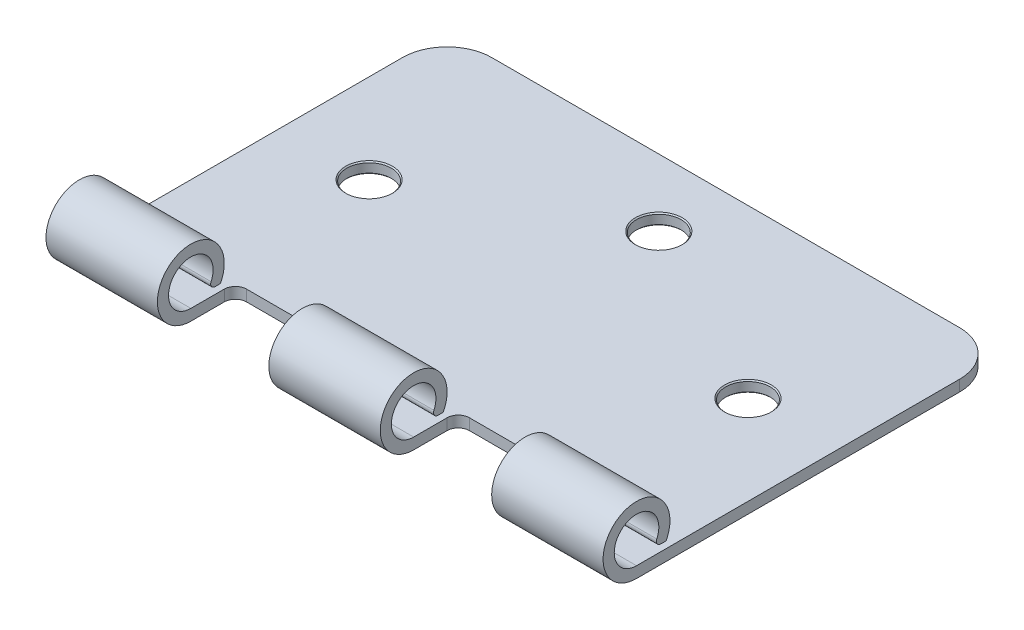
from build123d import *

# Parameters (mm, degrees)
SKETCH1_R           = 10
BOSS_EXTRUDE1_DEPTH = 5
BOSS_EXTRUDE2_DEPTH = 125
SKETCH3_W           = 50
SKETCH3_H           = 35
CUT_EXTRUDE1_DEPTH  = 30
CHAMFER1_SIZE       = 0.5
FILLET2_R           = 5
WRAP1_OUTLINE_W     = 1.13974359
WRAP1_OUTLINE_H     = 12.7
WRAP1_DEPTH         = 5
WRAP2_DEPTH         = 2


# Read off the part's stored shape, not the designer's step: Wrap1, Wrap2
with BuildPart() as part:
    # Sketch1 → Boss-Extrude1 (new body)
    with BuildSketch(Plane(origin=(0, 0, 0), x_dir=(1, 0, 0), z_dir=(0, 1, 0))):
        with BuildLine():
            Line((-105, 150), (105, 150))
            ThreePointArc((105, 150), (119.142135624, 144.142135624), (125, 130))
            Line((125, 130), (125, 0))
            Line((125, 0), (-125, 0))
            Line((-125, 0), (-125, 130))
            ThreePointArc((-125, 130), (-119.142135624, 144.142135624), (-105, 150))
        make_face()
        with Locations(Location((-85, 75, 0), (0, 0, 270))):
            Circle(SKETCH1_R, mode=Mode.SUBTRACT)
        with Locations(Location((85, 75, 0), (0, 0, 270))):
            Circle(SKETCH1_R, mode=Mode.SUBTRACT)
        with Locations(Location((0, 120, 0), (0, 0, 270))):
            Circle(SKETCH1_R, mode=Mode.SUBTRACT)
    extrude(amount=BOSS_EXTRUDE1_DEPTH)

    # Sketch2 → Boss-Extrude2 (add, symmetric)
    with BuildSketch(Plane(origin=(0, 0, 0), x_dir=(0, 0, -1), z_dir=(1, 0, 0))):
        with BuildLine():
            Line((0, 0), (-15, 0))
            ThreePointArc((-15, 0), (-22.745966692, 27.845232579), (-1.733500839, 8))
            Line((-1.733500839, 8), (-4.091287885, 8))
            ThreePointArc((-4.091287885, 8), (-5.774538708, 8.91987655), (-5.909406571, 10.833333333))
            ThreePointArc((-5.909406571, 10.833333333), (-20.400617249, 23.416254115), (-15, 5))
            Line((-15, 5), (0, 5))
            Line((0, 5), (0, 0))
        make_face()
    extrude(amount=BOSS_EXTRUDE2_DEPTH, both=True)

    # Sketch3 → Cut-Extrude1 (cut, symmetric)
    with BuildSketch(Plane(origin=(0, 0, 0), x_dir=(1, 0, 0), z_dir=(0, 1, 0))):
        with Locations((-50, -12.5)):
            Rectangle(SKETCH3_W, SKETCH3_H)
        with Locations((50, -12.5)):
            Rectangle(SKETCH3_W, SKETCH3_H)
    extrude(amount=CUT_EXTRUDE1_DEPTH, both=True, mode=Mode.SUBTRACT)

    # Chamfer1
    chamfer1_edges = [part.edges().sort_by_distance(p)[0] for p in [
        (-85, 0, -85),
        (-85, 5, -85),
        (85, 0, -85),
        (85, 5, -85),
        (0, 0, -130),
        (0, 5, -130),
    ]]
    chamfer(chamfer1_edges, length=CHAMFER1_SIZE)

    # Fillet2
    fillet2_edges = [part.edges().sort_by_distance(p)[0] for p in [
        (-25, 2.5, -5),
        (-75, 2.5, -5),
        (75, 2.5, -5),
        (25, 2.5, -5),
    ]]
    fillet(fillet2_edges, radius=FILLET2_R)

    # Wrap1 outline → Wrap1 (add)
    # profile 1 of 17: a face of its own
    with BuildSketch(Plane.XZ):
        with BuildLine():
            add(Edge.make_bspline(
                [(-60.70987489, -35.845821008), (-60.610023001, -36.012968919), (-60.418710634, -36.333217866), (-60.099572845, -36.765954184), (-59.768890568, -37.13375401), (-59.424214986, -37.4344777), (-59.067649974, -37.671237947), (-58.696867836, -37.838886045), (-58.313118066, -37.94344687), (-58.051955914, -37.956147184), (-57.921573608, -37.962487674)],
                knots=[0, 0, 0, 0, 0.159004299, 0.3046461, 0.438546905, 0.562322299, 0.677432543, 0.786897393, 0.893610889, 1, 1, 1, 1], degree=3))
            Line((-60.70987489, -35.845821008), (-61.783472647, -36.489470848))
            add(Edge.make_bspline(
                [(-57.921573608, -39.265051777), (-58.017496139, -39.263196918), (-58.208133154, -39.25951056), (-58.490107559, -39.226921343), (-58.766385497, -39.18081271), (-59.033500178, -39.107609656), (-59.294893072, -39.018793196), (-59.549427323, -38.909434104), (-59.797226289, -38.778380258), (-60.039678662, -38.628538312), (-60.276167809, -38.454157353), (-60.504475593, -38.251053523), (-60.732092923, -38.024828405), (-60.952301476, -37.769338646), (-61.169555456, -37.488711889), (-61.3795714, -37.180322566), (-61.586696489, -36.845850454), (-61.716655473, -36.610482857), (-61.783472647, -36.489470848)],
                knots=[0, 0, 0, 0, 0.057208269, 0.11369606, 0.169177916, 0.224159217, 0.278719878, 0.333794217, 0.389241459, 0.445822073, 0.503704281, 0.564293892, 0.627975416, 0.69503826, 0.765372726, 0.839611443, 0.91753775, 1, 1, 1, 1], degree=3))
            add(Edge.make_bspline(
                [(-54.293729057, -35.828012514), (-54.29611353, -35.941871153), (-54.30083617, -36.167377374), (-54.355122914, -36.498502938), (-54.434659985, -36.82010638), (-54.554537948, -37.128212416), (-54.700853408, -37.428457698), (-54.886513793, -37.712966365), (-55.101715964, -37.988035297), (-55.348581339, -38.24632968), (-55.618713613, -38.48344302), (-55.90422302, -38.694368471), (-56.205576867, -38.870239245), (-56.521140359, -39.0137523), (-56.850985981, -39.125996778), (-57.195002797, -39.207323475), (-57.55375788, -39.257237054), (-57.797599628, -39.262417789), (-57.921573608, -39.265051777)],
                knots=[0, 0, 0, 0, 0.061484255, 0.121774528, 0.18091956, 0.240256115, 0.300114444, 0.361145948, 0.423500582, 0.488669361, 0.553954105, 0.617581261, 0.680238427, 0.742187389, 0.804663212, 0.868258989, 0.933020257, 1, 1, 1, 1], degree=3))
            add(Edge.make_bspline(
                [(-57.28555598, -31.729514918), (-57.147721381, -31.829813566), (-56.880823782, -32.024027995), (-56.501066277, -32.315822034), (-56.156737317, -32.60120108), (-55.846627978, -32.878342683), (-55.567674624, -33.145144621), (-55.322972038, -33.404816732), (-55.110026855, -33.655498667), (-54.880776548, -33.976890585), (-54.646523889, -34.371610519), (-54.445350419, -34.855220128), (-54.318501558, -35.340709633), (-54.301913488, -35.667015583), (-54.293729057, -35.828012514)],
                knots=[0, 0, 0, 0, 0.09697231, 0.187773439, 0.272396139, 0.351320997, 0.424334774, 0.491908784, 0.55423322, 0.611267658, 0.716347845, 0.814540086, 0.908495456, 1, 1, 1, 1], degree=3))
            add(Edge.make_bspline(
                [(-58.992627294, -30.465111873), (-58.964827457, -30.48992051), (-58.898781408, -30.548860151), (-58.778037335, -30.645352141), (-58.618587752, -30.764379343), (-58.424596337, -30.91165332), (-58.192486196, -31.082491769), (-57.922231806, -31.274710304), (-57.616845673, -31.49454897), (-57.400140435, -31.648246331), (-57.28555598, -31.729514918)],
                knots=[0, 0, 0, 0, 0.052594282, 0.124951974, 0.218093899, 0.333502411, 0.468789179, 0.624937586, 0.801683048, 1, 1, 1, 1], degree=3))
            add(Edge.make_bspline(
                [(-59.829626493, -28.824186392), (-59.828200005, -28.892227472), (-59.825344696, -29.028420891), (-59.785521859, -29.229630336), (-59.734361437, -29.430331482), (-59.653289601, -29.629621997), (-59.541365214, -29.830987243), (-59.39438929, -30.03789469), (-59.209283843, -30.252168033), (-59.067490113, -30.391531932), (-58.992627294, -30.465111873)],
                knots=[0, 0, 0, 0, 0.107285214, 0.214745861, 0.32293856, 0.434116163, 0.553412311, 0.686072985, 0.834255992, 1, 1, 1, 1], degree=3))
            add(Edge.make_bspline(
                [(-57.967366878, -27.216333828), (-58.098563402, -27.220730568), (-58.35156354, -27.229209267), (-58.710756682, -27.321810356), (-59.034040353, -27.467613106), (-59.311816803, -27.671956027), (-59.543090977, -27.914057915), (-59.710387928, -28.192655475), (-59.811081382, -28.500294478), (-59.823368739, -28.714894203), (-59.829626493, -28.824186392)],
                knots=[0, 0, 0, 0, 0.143073084, 0.275902964, 0.402370856, 0.528413645, 0.650356379, 0.765895086, 0.880774131, 1, 1, 1, 1], degree=3))
            add(Edge.make_bspline(
                [(-55.486898128, -28.844538956), (-55.549113368, -28.764388566), (-55.668925375, -28.610037652), (-55.850823799, -28.393878879), (-56.022268893, -28.196424796), (-56.191180344, -28.024919903), (-56.348637235, -27.869972162), (-56.501461931, -27.737312473), (-56.647455149, -27.625641026), (-56.831485081, -27.506465823), (-57.062689374, -27.388332224), (-57.352918977, -27.288368427), (-57.656217746, -27.228297202), (-57.86279098, -27.220354667), (-57.967366878, -27.216333828)],
                knots=[0, 0, 0, 0, 0.098469431, 0.189629101, 0.274184089, 0.352183161, 0.423198873, 0.488550946, 0.548473346, 0.601440164, 0.701198082, 0.799591802, 0.898545098, 1, 1, 1, 1], degree=3))
            Line((-55.486898128, -28.844538956), (-54.45654957, -28.063509309))
            add(Edge.make_bspline(
                [(-57.840163352, -25.913769726), (-57.690506188, -25.918931556), (-57.392885855, -25.929196788), (-56.955101558, -26.018450688), (-56.533604101, -26.166135982), (-56.194538541, -26.333734827), (-55.929171092, -26.501125964), (-55.726795747, -26.653597898), (-55.52171814, -26.829130435), (-55.312284056, -27.028191128), (-55.102042234, -27.252606482), (-54.887871422, -27.500839553), (-54.669270789, -27.771373341), (-54.528642383, -27.964502244), (-54.45654957, -28.063509309)],
                knots=[0, 0, 0, 0, 0.107232799, 0.213251813, 0.318830447, 0.426793531, 0.483645951, 0.543603822, 0.60830765, 0.67712676, 0.750685636, 0.828713418, 0.912190348, 1, 1, 1, 1], degree=3))
            add(Edge.make_bspline(
                [(-60.969370083, -28.877611873), (-60.964634039, -28.743246691), (-60.95526318, -28.477388288), (-60.876013303, -28.089019275), (-60.750925946, -27.718228561), (-60.575684496, -27.368687065), (-60.349779244, -27.04949622), (-60.08835528, -26.756984424), (-59.776982173, -26.511081283), (-59.435342654, -26.2962261), (-59.061395247, -26.128056599), (-58.66954254, -26.001198186), (-58.259161736, -25.929318879), (-57.98120179, -25.919003704), (-57.840163352, -25.913769726)],
                knots=[0, 0, 0, 0, 0.083785371, 0.165779888, 0.246280008, 0.327460928, 0.408796954, 0.489715241, 0.571376032, 0.655523321, 0.741019483, 0.826546761, 0.911988852, 1, 1, 1, 1], degree=3))
            add(Edge.make_bspline(
                [(-60.25957441, -30.811105463), (-60.315717645, -30.736353129), (-60.426130853, -30.589342633), (-60.571876073, -30.359563863), (-60.695752463, -30.124348014), (-60.792861497, -29.88306302), (-60.874635777, -29.639096278), (-60.929637411, -29.389264615), (-60.964077623, -29.134689057), (-60.967604545, -28.963371497), (-60.969370083, -28.877611873)],
                knots=[0, 0, 0, 0, 0.133506769, 0.262558979, 0.388264447, 0.512667355, 0.63372227, 0.75539386, 0.877552945, 1, 1, 1, 1], degree=3))
            add(Edge.make_bspline(
                [(-58.17852473, -32.538529341), (-58.312143231, -32.443357037), (-58.567611629, -32.26139484), (-58.924875627, -31.99134101), (-59.24435125, -31.744438969), (-59.524618539, -31.51836441), (-59.765554219, -31.313086673), (-59.969056882, -31.130577008), (-60.129942503, -30.965899516), (-60.219407039, -30.859069505), (-60.25957441, -30.811105463)],
                knots=[0, 0, 0, 0, 0.181535301, 0.347081672, 0.495567816, 0.628357302, 0.74551967, 0.845830751, 0.930781807, 1, 1, 1, 1], degree=3))
            add(Edge.make_bspline(
                [(-55.888861269, -34.563609469), (-55.945723212, -34.490868138), (-56.065097748, -34.338156812), (-56.270320722, -34.1108441), (-56.511134908, -33.876371551), (-56.779299236, -33.62578583), (-57.084582159, -33.37074154), (-57.417421997, -33.099076645), (-57.786316571, -32.821122351), (-58.045031887, -32.634713328), (-58.17852473, -32.538529341)],
                knots=[0, 0, 0, 0, 0.090279215, 0.189529918, 0.299197872, 0.418925887, 0.548376285, 0.68813637, 0.839083502, 1, 1, 1, 1], degree=3))
            add(Edge.make_bspline(
                [(-55.433472647, -35.810204021), (-55.438822289, -35.704464366), (-55.449697328, -35.4895111), (-55.541614413, -35.172375216), (-55.686210252, -34.858530748), (-55.81960613, -34.664397584), (-55.888861269, -34.563609469)],
                knots=[0, 0, 0, 0, 0.234723374, 0.477158319, 0.728556284, 1, 1, 1, 1], degree=3))
            add(Edge.make_bspline(
                [(-57.921573608, -37.962487674), (-57.810224143, -37.959386434), (-57.589473567, -37.953238218), (-57.264490571, -37.894162165), (-56.948870888, -37.803403869), (-56.649119546, -37.67342506), (-56.369372601, -37.516168269), (-56.124056878, -37.326226425), (-55.911980982, -37.113569621), (-55.738502195, -36.876323989), (-55.605406067, -36.621173192), (-55.503109133, -36.359277597), (-55.446339866, -36.086523078), (-55.437788217, -35.902879399), (-55.433472647, -35.810204021)],
                knots=[0, 0, 0, 0, 0.091263605, 0.180930311, 0.27008822, 0.360156133, 0.448342532, 0.532665842, 0.613833704, 0.693981527, 0.772715977, 0.849335172, 0.923967327, 1, 1, 1, 1], degree=3))
        make_face()
    # profile 2 of 17: a face of its own
    with BuildSketch(Plane.XZ):
        with BuildLine():
            add(Edge.make_bspline(
                [(-37.075459826, -26.239410751), (-36.852415212, -26.241016648), (-36.421494178, -26.244119233), (-35.798786154, -26.263791138), (-35.22262793, -26.298590828), (-34.694914413, -26.349280251), (-34.214196873, -26.411521259), (-33.781821352, -26.489537012), (-33.395552147, -26.581659802), (-33.157991606, -26.660201864), (-33.045652134, -26.697343444)],
                knots=[0, 0, 0, 0, 0.164289216, 0.317405911, 0.458843612, 0.589366542, 0.707831319, 0.815770031, 0.912879903, 1, 1, 1, 1], degree=3))
            Line((-37.075459826, -26.239410751), (-39.639882903, -26.239410751))
            Line((-39.639882903, -26.239410751), (-39.639882903, -38.939410751))
            Line((-39.639882903, -38.939410751), (-35.70420582, -38.939410751))
            add(Edge.make_bspline(
                [(-29.219370083, -32.749687194), (-29.221652336, -32.906663688), (-29.226149755, -33.216002265), (-29.266533273, -33.671899229), (-29.325230205, -34.11427133), (-29.416104866, -34.541012013), (-29.526422558, -34.955860118), (-29.667806764, -35.354394262), (-29.82976985, -35.74027037), (-30.018636552, -36.108270926), (-30.225978149, -36.456916305), (-30.448488474, -36.785576079), (-30.685930198, -37.089560455), (-30.940567494, -37.36978999), (-31.20910978, -37.625842232), (-31.493315208, -37.859856116), (-31.793917135, -38.067252758), (-32.109569186, -38.256181979), (-32.449479712, -38.420992983), (-32.820086998, -38.560439019), (-33.222971558, -38.675996738), (-33.657144487, -38.772411131), (-34.123355964, -38.848891629), (-34.622063068, -38.900150253), (-35.152499577, -38.934813752), (-35.51673291, -38.937848665), (-35.70420582, -38.939410751)],
                knots=[0, 0, 0, 0, 0.046080683, 0.0908068, 0.134295271, 0.177024386, 0.218822734, 0.260244116, 0.301079867, 0.341613894, 0.381583419, 0.420119591, 0.458074619, 0.494738488, 0.531194623, 0.566933698, 0.602712651, 0.638326606, 0.674853249, 0.713467371, 0.754441804, 0.797815361, 0.843989456, 0.89307157, 0.944963346, 1, 1, 1, 1], degree=3))
            add(Edge.make_bspline(
                [(-33.045652134, -26.697343444), (-32.89871408, -26.753334861), (-32.608170039, -26.864047997), (-32.194487052, -27.072895148), (-31.805049306, -27.309525545), (-31.437768409, -27.574251104), (-31.101033982, -27.874567454), (-30.781691042, -28.197717451), (-30.49280333, -28.555452285), (-30.22825037, -28.940352956), (-29.989723835, -29.34788526), (-29.782390319, -29.777272654), (-29.610200115, -30.226334523), (-29.467258978, -30.69382206), (-29.354604689, -31.180763203), (-29.277744537, -31.687724945), (-29.227049802, -32.212703718), (-29.221955102, -32.568936772), (-29.219370083, -32.749687194)],
                knots=[0, 0, 0, 0, 0.061544966, 0.121694296, 0.181154855, 0.239875389, 0.298701942, 0.357647424, 0.417604843, 0.478494041, 0.540407051, 0.602344994, 0.665004328, 0.728559309, 0.793650542, 0.860534268, 0.929235961, 1, 1, 1, 1], degree=3))
        make_face()
        with BuildLine():
            add(Edge.make_bspline(
                [(-37.04238691, -37.636846649), (-36.832915393, -37.635946413), (-36.430024953, -37.634214931), (-35.850694506, -37.619021365), (-35.321360696, -37.594194906), (-34.841948362, -37.559451053), (-34.412728188, -37.513482078), (-34.032803152, -37.462228859), (-33.703418644, -37.398375252), (-33.504103258, -37.340496056), (-33.411998288, -37.313749694)],
                knots=[0, 0, 0, 0, 0.171900665, 0.330627932, 0.475548836, 0.60674619, 0.725023803, 0.829742387, 0.92132282, 1, 1, 1, 1], degree=3))
            Line((-37.04238691, -37.636846649), (-38.500139314, -37.636846649))
            Line((-38.500139314, -37.636846649), (-38.500139314, -27.541974854))
            Line((-38.500139314, -27.541974854), (-37.607170564, -27.541974854))
            add(Edge.make_bspline(
                [(-33.704566397, -27.898144726), (-33.811069128, -27.868693687), (-34.037523156, -27.8060727), (-34.407054925, -27.737763491), (-34.822944182, -27.67751288), (-35.287037383, -27.62650228), (-35.798805506, -27.589899714), (-36.358642145, -27.562426658), (-36.966789282, -27.543896877), (-37.388365904, -27.542631568), (-37.607170564, -27.541974854)],
                knots=[0, 0, 0, 0, 0.084318617, 0.179284514, 0.286582528, 0.405111483, 0.535592873, 0.67819021, 0.83297584, 1, 1, 1, 1], degree=3))
            add(Edge.make_bspline(
                [(-30.359113673, -32.747143123), (-30.360976172, -32.598613066), (-30.36463507, -32.306824454), (-30.410624711, -31.878686789), (-30.477831498, -31.466914142), (-30.575018016, -31.071478976), (-30.698864347, -30.691609813), (-30.853422047, -30.32940759), (-31.030012352, -29.981047066), (-31.240118745, -29.654568653), (-31.470226756, -29.345802228), (-31.725597918, -29.062937249), (-32.002175029, -28.805329359), (-32.296941483, -28.568966711), (-32.618204671, -28.363358515), (-32.958396635, -28.179438272), (-33.322508071, -28.023352038), (-33.575828424, -27.94033445), (-33.704566397, -27.898144726)],
                knots=[0, 0, 0, 0, 0.070151176, 0.137812606, 0.203226247, 0.267174055, 0.330024003, 0.391794272, 0.453084399, 0.514333908, 0.574999993, 0.634865483, 0.694116315, 0.753441622, 0.8131258, 0.874079686, 0.936007013, 1, 1, 1, 1], degree=3))
            add(Edge.make_bspline(
                [(-33.411998288, -37.313749694), (-33.296071374, -37.272922611), (-33.066986458, -37.192243599), (-32.737217949, -37.045077229), (-32.429671104, -36.870753147), (-32.138986155, -36.676979182), (-31.869286577, -36.456920831), (-31.617376212, -36.215363243), (-31.383762247, -35.95107706), (-31.170858329, -35.664390302), (-30.980328197, -35.357087329), (-30.815332594, -35.032189276), (-30.670728465, -34.693255993), (-30.557231857, -34.33508276), (-30.468275309, -33.960871605), (-30.405266298, -33.570596203), (-30.366024298, -33.164329437), (-30.361447044, -32.888006015), (-30.359113673, -32.747143123)],
                knots=[0, 0, 0, 0, 0.0624145, 0.123338231, 0.183124538, 0.241782995, 0.300578883, 0.359680075, 0.418881641, 0.479530664, 0.540850536, 0.602303396, 0.664463212, 0.727805723, 0.792894815, 0.859672328, 0.928464401, 1, 1, 1, 1], degree=3))
        make_face(mode=Mode.SUBTRACT)
    # profile 3 of 17: a face of its own
    with BuildSketch(Plane.XZ):
        with BuildLine():
            add(Edge.make_bspline(
                [(-19.727442999, -26.239410751), (-19.556134854, -26.239599061), (-19.22790084, -26.239959869), (-18.757220495, -26.25089909), (-18.329739469, -26.26551023), (-17.946379516, -26.285764528), (-17.605961102, -26.309700727), (-17.310024616, -26.343272413), (-17.05624394, -26.378325485), (-16.904183395, -26.41396316), (-16.834834826, -26.43021604)],
                knots=[0, 0, 0, 0, 0.176955752, 0.33905508, 0.486318225, 0.618780923, 0.735618828, 0.838742477, 0.926457068, 1, 1, 1, 1], degree=3))
            Line((-19.727442999, -26.239410751), (-22.218088032, -26.239410751))
            Line((-22.218088032, -26.239410751), (-22.218088032, -38.939410751))
            Line((-22.218088032, -38.939410751), (-21.078344442, -38.939410751))
            Line((-21.078344442, -38.939410751), (-21.078344442, -33.07787229))
            Line((-21.078344442, -33.07787229), (-20.170111269, -33.07787229))
            add(Edge.make_bspline(
                [(-16.936597647, -32.869258508), (-17.016162545, -32.886178468), (-17.190533644, -32.923259544), (-17.477708664, -32.964655944), (-17.812064779, -32.999989524), (-18.193145623, -33.026482223), (-18.620609135, -33.049162131), (-19.094686555, -33.067189215), (-19.616308492, -33.077094685), (-19.980149863, -33.077605561), (-20.170111269, -33.07787229)],
                knots=[0, 0, 0, 0, 0.075173117, 0.164746258, 0.268016881, 0.385911876, 0.517789479, 0.663690977, 0.824413221, 1, 1, 1, 1], degree=3))
            add(Edge.make_bspline(
                [(-14.402703416, -29.645921168), (-14.404232586, -29.750343387), (-14.40722451, -29.95465251), (-14.443133888, -30.253548056), (-14.49150344, -30.539183357), (-14.565878459, -30.810925077), (-14.663289901, -31.067159445), (-14.777561064, -31.311802201), (-14.915387017, -31.540691296), (-15.0737554, -31.754657694), (-15.249928328, -31.953902233), (-15.443160418, -32.136981059), (-15.652671565, -32.302822515), (-15.877795931, -32.451798391), (-16.120728239, -32.580454034), (-16.377784054, -32.695687683), (-16.651197696, -32.792465531), (-16.840400532, -32.843374611), (-16.936597647, -32.869258508)],
                knots=[0, 0, 0, 0, 0.070118894, 0.137192353, 0.202016181, 0.264631407, 0.326116547, 0.386010305, 0.445811847, 0.505297697, 0.564633278, 0.624282625, 0.683902032, 0.743952771, 0.805387731, 0.868388031, 0.933084028, 1, 1, 1, 1], degree=3))
            add(Edge.make_bspline(
                [(-16.834834826, -26.43021604), (-16.747046861, -26.454244258), (-16.573539544, -26.501734499), (-16.323527187, -26.596852867), (-16.085660376, -26.709636723), (-15.859123007, -26.838175019), (-15.646698877, -26.987982638), (-15.445218671, -27.152986908), (-15.256460457, -27.336997457), (-15.081485692, -27.537950427), (-14.920795141, -27.752472332), (-14.782438864, -27.983765566), (-14.66658864, -28.227936867), (-14.567226484, -28.484816396), (-14.495712949, -28.756561285), (-14.441839913, -29.041283355), (-14.407645607, -29.338952088), (-14.404370597, -29.542369322), (-14.402703416, -29.645921168)],
                knots=[0, 0, 0, 0, 0.062481339, 0.123490383, 0.183411094, 0.243153221, 0.302126735, 0.361709671, 0.421842292, 0.482931901, 0.544552254, 0.60568072, 0.667679738, 0.729984388, 0.794550921, 0.86034562, 0.928907356, 1, 1, 1, 1], degree=3))
        make_face()
        with BuildLine():
            add(Edge.make_bspline(
                [(-18.854826814, -31.803292963), (-18.746260226, -31.803349074), (-18.536674666, -31.803457394), (-18.23392037, -31.788996726), (-17.953035242, -31.772303365), (-17.694882068, -31.747861585), (-17.459344478, -31.713313023), (-17.24602973, -31.678436145), (-17.056591875, -31.627979544), (-16.834889057, -31.56004155), (-16.587843768, -31.444171773), (-16.319084377, -31.275987886), (-16.091316821, -31.061609316), (-15.894219001, -30.820571186), (-15.737806244, -30.552422916), (-15.623303072, -30.265515631), (-15.556025158, -29.96279172), (-15.547003827, -29.755643331), (-15.542447006, -29.651009309)],
                knots=[0, 0, 0, 0, 0.072538371, 0.140033831, 0.202495681, 0.260575056, 0.313228338, 0.361583194, 0.404878361, 0.444127437, 0.516399693, 0.586506671, 0.655085374, 0.724383783, 0.793973529, 0.861637682, 0.930110942, 1, 1, 1, 1], degree=3))
            Line((-18.854826814, -31.803292963), (-21.078344442, -31.775308187))
            Line((-21.078344442, -31.775308187), (-21.078344442, -27.541974854))
            Line((-21.078344442, -27.541974854), (-18.755608064, -27.541974854))
            add(Edge.make_bspline(
                [(-15.542447006, -29.651009309), (-15.547028609, -29.548906703), (-15.556136269, -29.345939359), (-15.623830401, -29.048473571), (-15.737583625, -28.764589729), (-15.895268982, -28.499801677), (-16.08664394, -28.259630874), (-16.309072985, -28.050998441), (-16.562032533, -27.883279691), (-16.797338971, -27.775027498), (-17.006348989, -27.70893207), (-17.187893529, -27.662686506), (-17.392873977, -27.625763592), (-17.621357062, -27.595865967), (-17.87157186, -27.570271979), (-18.145668031, -27.552905719), (-18.442607251, -27.542740435), (-18.648748465, -27.542236226), (-18.755608064, -27.541974854)],
                knots=[0, 0, 0, 0, 0.070043755, 0.139238317, 0.208197455, 0.279173374, 0.349986812, 0.418353846, 0.487609584, 0.557411073, 0.595330157, 0.637964052, 0.685912778, 0.738185165, 0.796102647, 0.858516544, 0.926657726, 1, 1, 1, 1], degree=3))
        make_face(mode=Mode.SUBTRACT)
    # profile 4 of 17: a face of its own
    with BuildSketch(Plane.XZ):
        with BuildLine():
            add(Edge.make_bspline(
                [(50.448198026, -26.239410751), (50.619506171, -26.239599061), (50.947740185, -26.239959869), (51.41842053, -26.25089909), (51.845901556, -26.26551023), (52.22926151, -26.285764528), (52.569679923, -26.309700727), (52.86561641, -26.343272413), (53.119397086, -26.378325485), (53.271457631, -26.41396316), (53.340806199, -26.43021604)],
                knots=[0, 0, 0, 0, 0.176955752, 0.33905508, 0.486318225, 0.618780923, 0.735618828, 0.838742477, 0.926457068, 1, 1, 1, 1], degree=3))
            Line((50.448198026, -26.239410751), (47.957552994, -26.239410751))
            Line((47.957552994, -26.239410751), (47.957552994, -38.939410751))
            Line((47.957552994, -38.939410751), (49.097296584, -38.939410751))
            Line((49.097296584, -38.939410751), (49.097296584, -33.07787229))
            Line((49.097296584, -33.07787229), (50.005529757, -33.07787229))
            add(Edge.make_bspline(
                [(53.239043379, -32.869258508), (53.159478481, -32.886178468), (52.985107382, -32.923259544), (52.697932361, -32.964655944), (52.363576247, -32.999989524), (51.982495402, -33.026482223), (51.55503189, -33.049162131), (51.080954471, -33.067189215), (50.559332534, -33.077094685), (50.195491162, -33.077605561), (50.005529757, -33.07787229)],
                knots=[0, 0, 0, 0, 0.075173117, 0.164746258, 0.268016881, 0.385911876, 0.517789479, 0.663690977, 0.824413221, 1, 1, 1, 1], degree=3))
            add(Edge.make_bspline(
                [(55.77293761, -29.645921168), (55.77140844, -29.750343387), (55.768416516, -29.95465251), (55.732507138, -30.253548056), (55.684137585, -30.539183357), (55.609762567, -30.810925077), (55.512351124, -31.067159445), (55.398079961, -31.311802201), (55.260254008, -31.540691296), (55.101885626, -31.754657694), (54.925712698, -31.953902233), (54.732480608, -32.136981059), (54.522969461, -32.302822515), (54.297845095, -32.451798391), (54.054912786, -32.580454034), (53.797856972, -32.695687683), (53.52444333, -32.792465531), (53.335240493, -32.843374611), (53.239043379, -32.869258508)],
                knots=[0, 0, 0, 0, 0.070118894, 0.137192353, 0.202016181, 0.264631407, 0.326116547, 0.386010305, 0.445811847, 0.505297697, 0.564633278, 0.624282625, 0.683902032, 0.743952771, 0.805387731, 0.868388031, 0.933084028, 1, 1, 1, 1], degree=3))
            add(Edge.make_bspline(
                [(53.340806199, -26.43021604), (53.428594165, -26.454244258), (53.602101482, -26.501734499), (53.852113838, -26.596852867), (54.089980649, -26.709636723), (54.316518018, -26.838175019), (54.528942148, -26.987982638), (54.730422354, -27.152986908), (54.919180568, -27.336997457), (55.094155333, -27.537950427), (55.254845884, -27.752472332), (55.393202162, -27.983765566), (55.509052386, -28.227936867), (55.608414542, -28.484816396), (55.679928077, -28.756561285), (55.733801113, -29.041283355), (55.767995419, -29.338952088), (55.771270429, -29.542369322), (55.77293761, -29.645921168)],
                knots=[0, 0, 0, 0, 0.062481339, 0.123490383, 0.183411094, 0.243153221, 0.302126735, 0.361709671, 0.421842292, 0.482931901, 0.544552254, 0.60568072, 0.667679738, 0.729984388, 0.794550921, 0.86034562, 0.928907356, 1, 1, 1, 1], degree=3))
        make_face()
        with BuildLine():
            add(Edge.make_bspline(
                [(51.320814212, -31.803292963), (51.4293808, -31.803349074), (51.63896636, -31.803457394), (51.941720656, -31.788996726), (52.222605784, -31.772303365), (52.480758957, -31.747861585), (52.716296548, -31.713313023), (52.929611296, -31.678436145), (53.119049151, -31.627979544), (53.340751969, -31.56004155), (53.587797258, -31.444171773), (53.856556648, -31.275987886), (54.084324205, -31.061609316), (54.281422024, -30.820571186), (54.437834781, -30.552422916), (54.552337953, -30.265515631), (54.619615867, -29.96279172), (54.628637199, -29.755643331), (54.63319402, -29.651009309)],
                knots=[0, 0, 0, 0, 0.072538371, 0.140033831, 0.202495681, 0.260575056, 0.313228338, 0.361583194, 0.404878361, 0.444127437, 0.516399693, 0.586506671, 0.655085374, 0.724383783, 0.793973529, 0.861637682, 0.930110942, 1, 1, 1, 1], degree=3))
            Line((51.320814212, -31.803292963), (49.097296584, -31.775308187))
            Line((49.097296584, -31.775308187), (49.097296584, -27.541974854))
            Line((49.097296584, -27.541974854), (51.420032962, -27.541974854))
            add(Edge.make_bspline(
                [(54.63319402, -29.651009309), (54.628612417, -29.548906703), (54.619504757, -29.345939359), (54.551810625, -29.048473571), (54.4380574, -28.764589729), (54.280372043, -28.499801677), (54.088997086, -28.259630874), (53.866568041, -28.050998441), (53.613608493, -27.883279691), (53.378302054, -27.775027498), (53.169292036, -27.70893207), (52.987747496, -27.662686506), (52.782767049, -27.625763592), (52.554283963, -27.595865967), (52.304069166, -27.570271979), (52.029972995, -27.552905719), (51.733033775, -27.542740435), (51.526892561, -27.542236226), (51.420032962, -27.541974854)],
                knots=[0, 0, 0, 0, 0.070043755, 0.139238317, 0.208197455, 0.279173374, 0.349986812, 0.418353846, 0.487609584, 0.557411073, 0.595330157, 0.637964052, 0.685912778, 0.738185165, 0.796102647, 0.858516544, 0.926657726, 1, 1, 1, 1], degree=3))
        make_face(mode=Mode.SUBTRACT)
    # profile 5 of 17: a face of its own
    with BuildSketch(Plane.XZ):
        with BuildLine():
            add(Edge.make_bspline(
                [(81.434976872, -26.239410751), (81.604580396, -26.239975306), (81.930237948, -26.241059314), (82.396775244, -26.247103654), (82.82069071, -26.264427745), (83.201762698, -26.279336033), (83.539984218, -26.306521077), (83.836392387, -26.332503997), (84.089622032, -26.366516995), (84.242914121, -26.398105244), (84.312320622, -26.412407546)],
                knots=[0, 0, 0, 0, 0.176257755, 0.338434414, 0.484822051, 0.617157578, 0.734698361, 0.837385184, 0.926372421, 1, 1, 1, 1], degree=3))
            Line((81.434976872, -26.239410751), (78.89345043, -26.239410751))
            Line((78.89345043, -26.239410751), (78.89345043, -38.939410751))
            Line((78.89345043, -38.939410751), (80.03319402, -38.939410751))
            Line((80.03319402, -38.939410751), (80.03319402, -33.07787229))
            Line((80.03319402, -33.07787229), (80.959235686, -33.07787229))
            Line((80.959235686, -33.07787229), (85.625061007, -38.939410751))
            Line((85.625061007, -38.939410751), (87.034476071, -38.939410751))
            Line((87.034476071, -38.939410751), (82.368650751, -33.07787229))
            add(Edge.make_bspline(
                [(86.871655558, -29.635744886), (86.866325194, -29.804963694), (86.855924272, -30.135153418), (86.758950324, -30.614345759), (86.600104095, -31.061346986), (86.381216732, -31.475594272), (86.102471778, -31.8490129), (85.767464679, -32.177001123), (85.376008545, -32.451465949), (85.011593599, -32.641794697), (84.689687789, -32.763688966), (84.424681197, -32.849455182), (84.135603878, -32.915720028), (83.82522555, -32.975083934), (83.492254571, -33.01990294), (83.137489, -33.052729154), (82.760675821, -33.073245274), (82.501816912, -33.076300549), (82.368650751, -33.07787229)],
                knots=[0, 0, 0, 0, 0.078780236, 0.153720644, 0.22671353, 0.299191166, 0.371189997, 0.443006414, 0.516689173, 0.593217217, 0.633872918, 0.676989142, 0.722899506, 0.771958611, 0.824211323, 0.879378651, 0.937948119, 1, 1, 1, 1], degree=3))
            add(Edge.make_bspline(
                [(84.312320622, -26.412407546), (84.405236087, -26.435364666), (84.589084877, -26.480789169), (84.853789403, -26.57679972), (85.106027093, -26.687905215), (85.344750169, -26.818402143), (85.568762897, -26.969259201), (85.780375054, -27.137872102), (85.980546878, -27.323318249), (86.161183079, -27.530273245), (86.331504781, -27.747394295), (86.47515494, -27.982176498), (86.598985309, -28.227691184), (86.697575471, -28.486435242), (86.77696126, -28.755899386), (86.832936472, -29.038524448), (86.866505067, -29.333022844), (86.869922657, -29.53389297), (86.871655558, -29.635744886)],
                knots=[0, 0, 0, 0, 0.064216843, 0.127063766, 0.188744538, 0.249132103, 0.309452533, 0.369826676, 0.430650142, 0.492351932, 0.554072106, 0.615689784, 0.676797703, 0.738439048, 0.80131691, 0.865184512, 0.931641324, 1, 1, 1, 1], degree=3))
        make_face()
        with BuildLine():
            add(Edge.make_bspline(
                [(82.358474468, -31.793116681), (82.467041467, -31.793164711), (82.677475231, -31.793257807), (82.981914786, -31.778766105), (83.265379192, -31.76228035), (83.526784207, -31.737064153), (83.766246609, -31.704566407), (83.983646708, -31.663915579), (84.179339382, -31.616555237), (84.407571221, -31.543252195), (84.662429492, -31.427116072), (84.939403647, -31.258149833), (85.175269272, -31.045627601), (85.374542658, -30.802609632), (85.534669453, -30.535415243), (85.647561764, -30.247247275), (85.719198626, -29.945380619), (85.72764792, -29.737905771), (85.731911968, -29.633200815)],
                knots=[0, 0, 0, 0, 0.07166815, 0.138913286, 0.20118457, 0.259124428, 0.312255041, 0.36068151, 0.405086143, 0.445101659, 0.51877778, 0.589461579, 0.658462242, 0.727283218, 0.796322487, 0.863174893, 0.930949381, 1, 1, 1, 1], degree=3))
            Line((82.358474468, -31.793116681), (80.03319402, -31.775308187))
            Line((80.03319402, -31.775308187), (80.03319402, -27.541974854))
            Line((80.03319402, -27.541974854), (82.41444402, -27.541974854))
            add(Edge.make_bspline(
                [(85.731911968, -29.633200815), (85.727549986, -29.531068962), (85.718906129, -29.328680896), (85.648334883, -29.032386593), (85.528993414, -28.75274366), (85.368167008, -28.490889671), (85.172227217, -28.25319743), (84.942474011, -28.049826332), (84.685189445, -27.882006845), (84.444719669, -27.774766665), (84.229784098, -27.709017483), (84.043167903, -27.662748974), (83.832306255, -27.625576187), (83.596175305, -27.595792652), (83.335783102, -27.570193283), (83.049813025, -27.552951114), (82.740162422, -27.542740808), (82.525543558, -27.542236114), (82.41444402, -27.541974854)],
                knots=[0, 0, 0, 0, 0.068814296, 0.136364825, 0.204019354, 0.273063739, 0.34291332, 0.410965444, 0.479168767, 0.549308007, 0.587651576, 0.630646669, 0.678878786, 0.731934299, 0.791111423, 0.85528319, 0.925085939, 1, 1, 1, 1], degree=3))
        make_face(mode=Mode.SUBTRACT)
    # profile 6 of 17: a face of its own
    with BuildSketch(Plane.XZ):
        Polygon((-89.648676974, -34.868897931), (-87.771152935, -38.939410751), (-86.532190596, -38.939410751), (-92.393729057, -26.239410751), (-92.55654957, -26.239410751), (-98.580908544, -38.939410751), (-97.336858064, -38.939410751), (-95.405908544, -34.868897931), align=None)
        Polygon((-92.487859666, -28.71479136), (-90.249077615, -33.566333828), (-94.78769941, -33.566333828), align=None, mode=Mode.SUBTRACT)
    # profile 7 of 17: a face of its own
    with BuildSketch(Plane.XZ):
        Polygon((-83.112959826, -32.810744886), (-77.223436589, -38.939410751), (-75.704626493, -38.939410751), (-82.433692999, -31.9381287), (-76.193088032, -26.239410751), (-77.818749089, -26.239410751), (-83.112959826, -31.075688796), (-83.112959826, -26.239410751), (-84.252703416, -26.239410751), (-84.252703416, -38.939410751), (-83.112959826, -38.939410751), align=None)
    # profile 8 of 17: a face of its own
    with BuildSketch(Plane.XZ):
        Polygon((-65.876882102, -34.868897931), (-63.999358064, -38.939410751), (-62.760395724, -38.939410751), (-68.621934185, -26.239410751), (-68.784754698, -26.239410751), (-74.809113673, -38.939410751), (-73.565063192, -38.939410751), (-71.634113673, -34.868897931), align=None)
        Polygon((-68.716064794, -28.71479136), (-66.477282743, -33.566333828), (-71.015904538, -33.566333828), align=None, mode=Mode.SUBTRACT)
    # profile 9 of 17: a face of its own
    with BuildSketch(Plane.XZ):
        Polygon((-44.036036749, -32.752231264), (-44.036036749, -38.939410751), (-42.89629316, -38.939410751), (-42.89629316, -26.239410751), (-44.036036749, -26.239410751), (-44.036036749, -31.449667162), (-50.548857262, -31.449667162), (-50.548857262, -26.239410751), (-51.688600852, -26.239410751), (-51.688600852, -38.939410751), (-50.548857262, -38.939410751), (-50.548857262, -32.752231264), align=None)
    # profile 10 of 17: a face of its own
    with BuildSketch(Plane.XZ):
        with Locations((-26.044370083, -32.589410751)):
            Rectangle(WRAP1_OUTLINE_W, WRAP1_OUTLINE_H)
    # profile 11 of 17: a face of its own
    with BuildSketch(Plane.XZ):
        Polygon((4.240245302, -29.801109469), (5.456311007, -38.939410751), (6.601142738, -38.939410751), (4.914423988, -26.239410751), (4.749059404, -26.239410751), (-0.48154957, -36.659923572), (-5.724878897, -26.239410751), (-5.88769941, -26.239410751), (-7.564241878, -38.939410751), (-6.416866076, -38.939410751), (-5.203344442, -29.780756905), (-0.601120884, -38.939410751), (-0.344169762, -38.939410751), align=None)
    # profile 12 of 17: a face of its own
    with BuildSketch(Plane.XZ):
        Polygon((17.161579436, -34.868897931), (19.039103475, -38.939410751), (20.278065815, -38.939410751), (14.416527353, -26.239410751), (14.25370684, -26.239410751), (8.229347866, -38.939410751), (9.473398347, -38.939410751), (11.404347866, -34.868897931), align=None)
        Polygon((14.322396744, -28.71479136), (16.561178795, -33.566333828), (12.022557001, -33.566333828), align=None, mode=Mode.SUBTRACT)
    # profile 13 of 17: a face of its own
    with BuildSketch(Plane.XZ):
        Polygon((30.210117097, -32.752231264), (30.210117097, -38.939410751), (31.349860686, -38.939410751), (31.349860686, -26.239410751), (30.210117097, -26.239410751), (30.210117097, -31.449667162), (23.697296584, -31.449667162), (23.697296584, -26.239410751), (22.557552994, -26.239410751), (22.557552994, -38.939410751), (23.697296584, -38.939410751), (23.697296584, -32.752231264), align=None)
    # profile 14 of 17: a face of its own
    with BuildSketch(Plane.XZ):
        Polygon((42.561579436, -34.868897931), (44.439103475, -38.939410751), (45.678065815, -38.939410751), (39.816527353, -26.239410751), (39.65370684, -26.239410751), (33.629347866, -38.939410751), (34.873398347, -38.939410751), (36.804347866, -34.868897931), align=None)
        Polygon((39.722396744, -28.71479136), (41.961178795, -33.566333828), (37.422557001, -33.566333828), align=None, mode=Mode.SUBTRACT)
    # profile 15 of 17: a face of its own
    with BuildSketch(Plane.XZ):
        Polygon((66.333374308, -34.868897931), (68.210898347, -38.939410751), (69.449860686, -38.939410751), (63.588322225, -26.239410751), (63.425501712, -26.239410751), (57.401142738, -38.939410751), (58.645193218, -38.939410751), (60.576142738, -34.868897931), align=None)
        Polygon((63.494191616, -28.71479136), (65.732973667, -33.566333828), (61.194351872, -33.566333828), align=None, mode=Mode.SUBTRACT)
    # profile 16 of 17: a face of its own
    with BuildSketch(Plane.XZ):
        Polygon((73.031911968, -27.541974854), (73.031911968, -38.939410751), (74.171655558, -38.939410751), (74.171655558, -27.541974854), (76.939604276, -27.541974854), (76.939604276, -26.239410751), (70.263963251, -26.239410751), (70.263963251, -27.541974854), align=None)
    # profile 17 of 17: a face of its own
    with BuildSketch(Plane.XZ):
        Polygon((97.59491277, -34.868897931), (99.472436808, -38.939410751), (100.711399148, -38.939410751), (94.849860686, -26.239410751), (94.687040174, -26.239410751), (88.662681199, -38.939410751), (89.90673168, -38.939410751), (91.837681199, -34.868897931), align=None)
        Polygon((94.755730077, -28.71479136), (96.994512129, -33.566333828), (92.455890334, -33.566333828), align=None, mode=Mode.SUBTRACT)
    extrude(amount=WRAP1_DEPTH)

    # Wrap2 outline → Wrap2 (cut)
    with BuildSketch(Plane(origin=(0, 0, 0), x_dir=(1, 0, 0), z_dir=(0, 1, 0))):
        with BuildLine():
            Line((-18.604352789, 59.707029801), (18.604352789, 59.707029801))
            ThreePointArc((18.604352789, 59.707029801), (22.846993476, 61.464389114), (24.604352789, 65.707029801))
            Line((24.604352789, 65.707029801), (24.604352789, 85.249630224))
            ThreePointArc((24.604352789, 85.249630224), (22.846993476, 89.492270911), (18.604352789, 91.249630224))
            Line((18.604352789, 91.249630224), (-18.604352789, 91.249630224))
            ThreePointArc((-18.604352789, 91.249630224), (-22.846993476, 89.492270911), (-24.604352789, 85.249630224))
            Line((-24.604352789, 85.249630224), (-24.604352789, 65.707029801))
            ThreePointArc((-24.604352789, 65.707029801), (-22.846993476, 61.464389114), (-18.604352789, 59.707029801))
        make_face()
        Polygon((6.175983812, 75.478330012), (-6.690284404, 70.067715702), (-6.690284404, 81.504398561), align=None, mode=Mode.SUBTRACT)
    extrude(amount=WRAP2_DEPTH, mode=Mode.SUBTRACT)


solid = part.part
